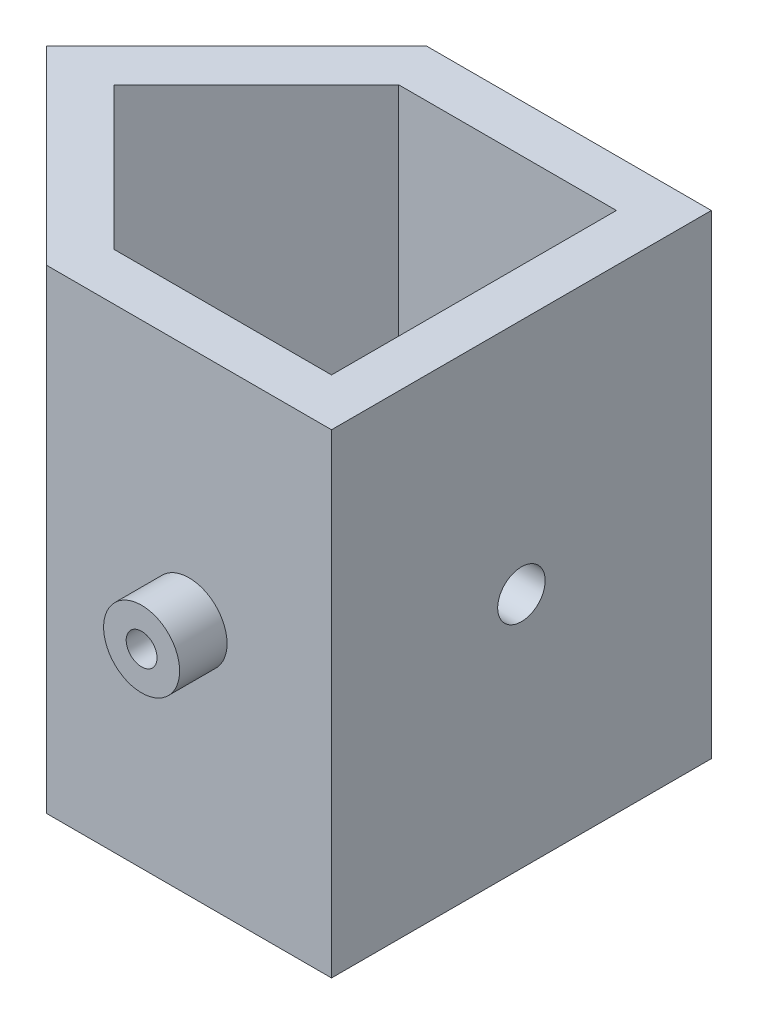
from build123d import *

# Parameters (mm, degrees)
SALIENTE_EXTRUIR1_DEPTH = 50
CROQUIS7_R              = 2.5
CORTAR_EXTRUIR1_DEPTH   = 5
CROQUIS8_R              = 4
SALIENTE_EXTRUIR2_DEPTH = 5
SALIENTE_EXTRUIR3_START = 5
CROQUIS15_R             = 4
SALIENTE_EXTRUIR3_DEPTH = 5
CROQUIS17_R             = 1.625
CORTAR_EXTRUIR4_DEPTH   = 6
CORTAR_EXTRUIR5_START   = -6
CROQUIS16_R             = 1.625
CORTAR_EXTRUIR5_DEPTH   = 6


with BuildPart() as part:
    # Croquis3 → Saliente-Extruir1 (new body)
    with BuildSketch(Plane(origin=(0, 0, 0), x_dir=(1, 0, 0), z_dir=(0, 1, 0))):
        Polygon((0, 0), (20.000000004, 20), (50.000000004, 20), (50.000000004, -20), (20.000000004, -20), align=None)
        Polygon((7.071067811, 2e-09), (22.071067819, 15), (45.000000004, 15), (45.000000004, -15), (22.071067815, -15), align=None, mode=Mode.SUBTRACT)
    extrude(amount=SALIENTE_EXTRUIR1_DEPTH)

    # Croquis7 → Cortar-Extruir1 (cut)
    with BuildSketch(Plane(origin=(50.000000004, 0, 0), x_dir=(0, 0, -1), z_dir=(1, 0, 0))):
        with Locations((0, 25)):
            Circle(CROQUIS7_R)
    extrude(amount=-CORTAR_EXTRUIR1_DEPTH, mode=Mode.SUBTRACT)

    # Croquis8 → Saliente-Extruir2 (add)
    with BuildSketch(Plane.XY.offset(20)):
        with Locations((35.000000004, 25)):
            Circle(CROQUIS8_R)
    extrude(amount=SALIENTE_EXTRUIR2_DEPTH)

    # Croquis15 → Saliente-Extruir3 (add)
    with BuildSketch(Plane(origin=(0, 0, -20), x_dir=(-1, 0, 0), z_dir=(0, 0, -1)).offset(SALIENTE_EXTRUIR3_START)):
        with Locations((-35.000000004, 25)):
            Circle(CROQUIS15_R)
    extrude(amount=-SALIENTE_EXTRUIR3_DEPTH)

    # Croquis17 → Cortar-Extruir4 (cut)
    with BuildSketch(Plane.XY.offset(25)):
        with Locations((35.000000004, 25)):
            Circle(CROQUIS17_R)
    extrude(amount=-CORTAR_EXTRUIR4_DEPTH, mode=Mode.SUBTRACT)

    # Croquis16 → Cortar-Extruir5 (cut)
    with BuildSketch(Plane(origin=(0, 0, -25), x_dir=(-1, 0, 0), z_dir=(0, 0, -1)).offset(CORTAR_EXTRUIR5_START)):
        with Locations((-35.000000004, 25)):
            Circle(CROQUIS16_R)
    extrude(amount=CORTAR_EXTRUIR5_DEPTH, mode=Mode.SUBTRACT)


solid = part.part
